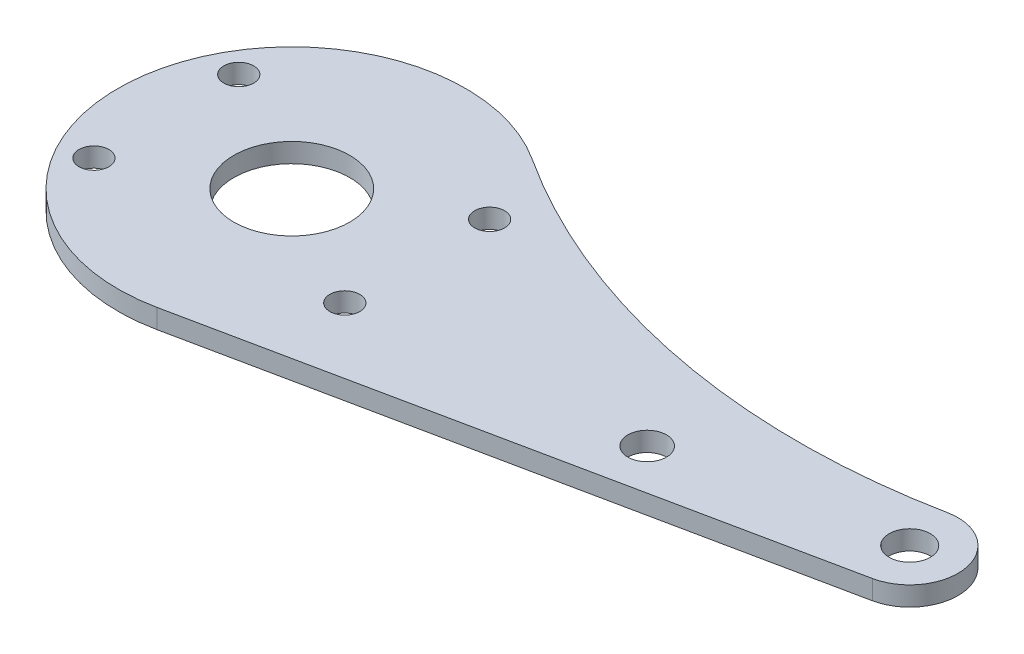
from build123d import *

# Parameters (mm, degrees)
SKETCH1_R                    = 9.525
SKETCH1_R_2                  = 3.3782
BOSS_EXTRUDE1_DEPTH          = 3.175
F_10_0_1935_DIAMETER_HOLE1_D = 4.9149
F_1_4_0_25_DIAMETER_HOLE2_D  = 6.35


with BuildPart() as part:
    # Sketch1 → Boss-Extrude1 (new body)
    with BuildSketch(Plane(origin=(0, 0, 0), x_dir=(1, 0, 0), z_dir=(0, 1, 0))):
        with BuildLine():
            ThreePointArc((100.049707031, 7.784632166), (56.215627572, 7.625525419), (15.545097656, 23.976667072))
            ThreePointArc((15.545097656, 23.976667072), (-28.085664922, 5.265553238), (5.804296875, -27.979291678))
            Line((5.804296875, -27.979291678), (103.212304687, -7.772025466))
            ThreePointArc((103.212304687, -7.772025466), (109.378390613, 1.581311391), (100.049707031, 7.784632166))
        make_face()
        Circle(SKETCH1_R, mode=Mode.SUBTRACT)
        with Locations((101.6, 0)):
            Circle(SKETCH1_R_2, mode=Mode.SUBTRACT)
    extrude(amount=BOSS_EXTRUDE1_DEPTH)

    # #10 (0.1935) Diameter Hole1 (through all)
    with Locations(Plane(origin=(0, 3.175, 0), x_dir=(1, 0, 0), z_dir=(0, 1, 0))):
        with Locations((-20.622229928, -11.90625), (-20.622229928, 11.90625), (20.622229928, 11.90625), (20.622229928, -11.90625)):
            Hole(F_10_0_1935_DIAMETER_HOLE1_D / 2)

    # 1/4 (0.25) Diameter Hole2 (through all)
    with Locations(Plane(origin=(0, 3.175, 0), x_dir=(1, 0, 0), z_dir=(0, 1, 0))):
        with Locations((65.848632136, -7.416612084)):
            Hole(F_1_4_0_25_DIAMETER_HOLE2_D / 2)


solid = part.part
